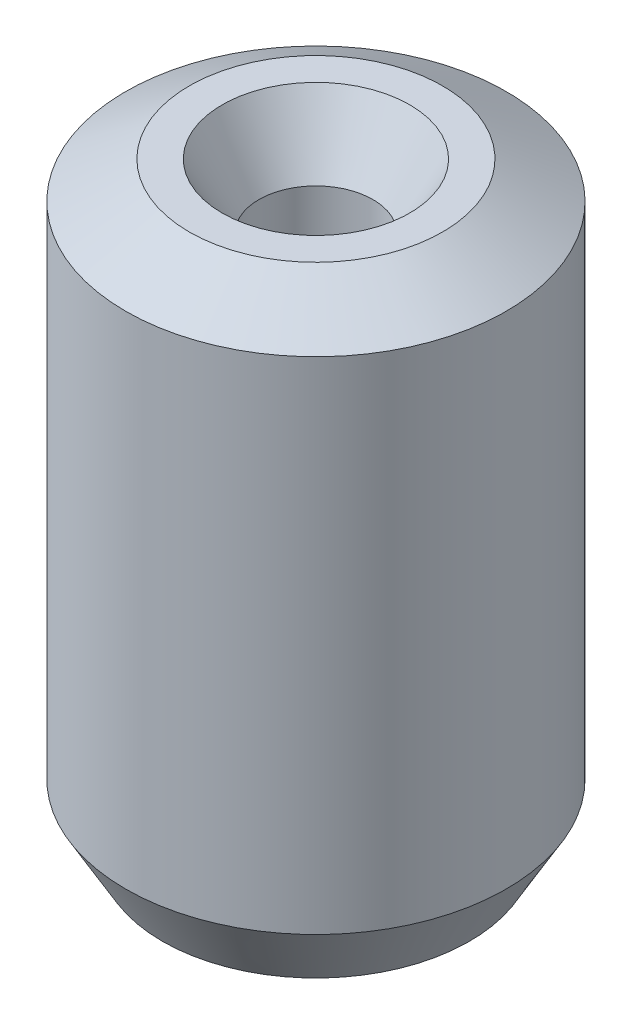
from build123d import *
from OCP.BRepFilletAPI import BRepFilletAPI_MakeChamfer

# Parameters (mm, degrees)
SKETCH1_R           = 5
BOSS_EXTRUDE1_DEPTH = 15.786227081
SKETCH2_R           = 1.4985387
CUT_EXTRUDE1_DEPTH  = 18.29754218
CHAMFER1_SIZE       = 0.965948171
CHAMFER1_SIZE2      = 1.67307131


with BuildPart() as part:
    # Sketch1 → Boss-Extrude1 (new body)
    with BuildSketch(Plane(origin=(0, 0, 0), x_dir=(1, 0, 0), z_dir=(0, 1, 0))):
        Circle(SKETCH1_R)
    extrude(amount=BOSS_EXTRUDE1_DEPTH)

    # Sketch2 → Cut-Extrude1 (cut, through all)
    with BuildSketch(Plane(origin=(0, 0, 0), x_dir=(1, 0, 0), z_dir=(0, 1, 0))):
        Circle(SKETCH2_R)
    extrude(amount=CUT_EXTRUDE1_DEPTH, mode=Mode.SUBTRACT)

    # Chamfer1: one chamfer whose edges measure the first distance from different faces: ONE call of the kernel's chamfer builder (chamfer() names one face for all edges)
    chamfer1_edges_1 = [part.edges().sort_by_distance(p)[0] for p in [
        (-1.4985387, 15.786227081, 0),
    ]]
    chamfer1_side_1 = [part.faces().sort_by_distance(p)[0] for p in [
        (-4.858578644, 15.786227081, 0),
    ]]
    chamfer1_edges_2 = [part.edges().sort_by_distance(p)[0] for p in [
        (-1.4985387, 0, 0),
    ]]
    chamfer1_side_2 = [part.faces().sort_by_distance(p)[0] for p in [
        (-1.4985387, 7.893113541, 0),
    ]]
    chamfer1_edges_3 = [part.edges().sort_by_distance(p)[0] for p in [
        (-5, 0, 0),
    ]]
    chamfer1_side_3 = [part.faces().sort_by_distance(p)[0] for p in [
        (-4.858578644, 0, 0),
    ]]
    chamfer1_edges_4 = [part.edges().sort_by_distance(p)[0] for p in [
        (-5, 15.786227081, 0),
    ]]
    chamfer1_side_4 = [part.faces().sort_by_distance(p)[0] for p in [
        (-5, 7.893113541, 0),
    ]]
    chamfer1 = BRepFilletAPI_MakeChamfer(part.part.solid().wrapped)
    for e in chamfer1_edges_1:
        chamfer1.Add(CHAMFER1_SIZE, CHAMFER1_SIZE2, e.wrapped, chamfer1_side_1[0].wrapped)  # the first distance lies on this face
    for e in chamfer1_edges_2:
        chamfer1.Add(CHAMFER1_SIZE, CHAMFER1_SIZE2, e.wrapped, chamfer1_side_2[0].wrapped)  # the first distance lies on this face
    for e in chamfer1_edges_3:
        chamfer1.Add(CHAMFER1_SIZE, CHAMFER1_SIZE2, e.wrapped, chamfer1_side_3[0].wrapped)  # the first distance lies on this face
    for e in chamfer1_edges_4:
        chamfer1.Add(CHAMFER1_SIZE, CHAMFER1_SIZE2, e.wrapped, chamfer1_side_4[0].wrapped)  # the first distance lies on this face
    add(Compound.cast(chamfer1.Shape()), mode=Mode.REPLACE)


solid = part.part
